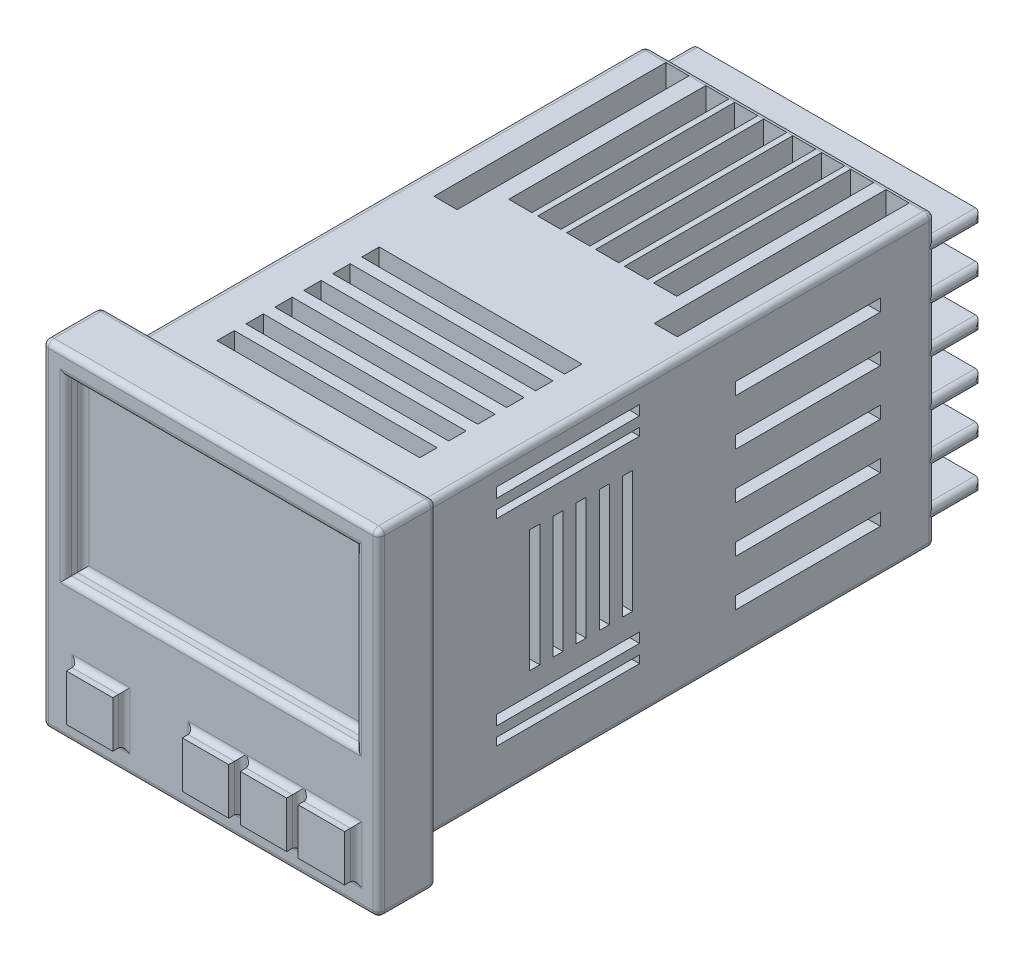
from build123d import *

# Parameters (mm, degrees)
ESBO_O1_W                = 50
ESBO_O1_H                = 50
RESSALTO_EXTRUS_O1_DEPTH = 100
ESBO_O2_W                = 58
ESBO_O2_H                = 58
ESBO_O2_W_2              = 50
ESBO_O2_H_2              = 50
RESSALTO_EXTRUS_O2_DEPTH = 10
ESBO_O3_W                = 50
ESBO_O3_H                = 30
CORTE_EXTRUS_O1_DEPTH    = 3
ESBO_O4_W                = 8
ESBO_O4_H                = 8
RESSALTO_EXTRUS_O3_DEPTH = 2
ESBO_O5_W                = 8
ESBO_O5_H                = 2
RESSALTO_EXTRUS_O4_DEPTH = 50
FILETE1_R                = 1
SKETCH1_W                = 25
SKETCH1_H                = 2.117547907
CUT_EXTRUDE1_DEPTH       = 10
LPATTERN1_COUNT          = 5
LPATTERN1_PITCH          = 8
SKETCH3_W                = 1.738778169
SKETCH3_H                = 21.0585356
CUT_EXTRUDE2_DEPTH       = 10
LPATTERN2_COUNT          = 5
LPATTERN2_PITCH          = 4
SKETCH5_W                = 24.653031409
SKETCH5_H                = 1.706748329
SKETCH5_H_2              = 1.327470922
CUT_EXTRUDE3_DEPTH       = 5
LPATTERN3_COUNT          = 2
LPATTERN3_PITCH          = 34
SKETCH7_W                = 4
SKETCH7_H                = 40
CUT_EXTRUDE4_DEPTH       = 5
SKETCH8_W                = 4
SKETCH8_H                = 34
CUT_EXTRUDE5_DEPTH       = 5
LPATTERN4_COUNT          = 6
LPATTERN4_PITCH          = 5
LPATTERN5_COUNT          = 2
LPATTERN5_PITCH          = 38
SKETCH10_W               = 35
SKETCH10_H               = 3
CUT_EXTRUDE6_DEPTH       = 5
LPATTERN6_COUNT          = 6
LPATTERN6_PITCH          = 5


with BuildPart() as part:
    # Esboço1 → Ressalto-extrusão1 (new body)
    with BuildSketch(Plane.XY):
        Rectangle(ESBO_O1_W, ESBO_O1_H)
    extrude(amount=RESSALTO_EXTRUS_O1_DEPTH)

    # Esboço2 → Ressalto-extrusão2 (add)
    with BuildSketch(Plane.XY.offset(100)):
        Rectangle(ESBO_O2_W, ESBO_O2_H)
        Rectangle(ESBO_O2_W_2, ESBO_O2_H_2, mode=Mode.SUBTRACT)
    extrude(amount=-RESSALTO_EXTRUS_O2_DEPTH)

    # Esboço3 → Corte-extrusão1 (cut)
    with BuildSketch(Plane.XY.offset(100)):
        with Locations((0, 10)):
            Rectangle(ESBO_O3_W, ESBO_O3_H)
    extrude(amount=-CORTE_EXTRUS_O1_DEPTH, mode=Mode.SUBTRACT)

    # Esboço4 → Ressalto-extrusão3 (add)
    with BuildSketch(Plane.XY.offset(100)):
        with Locations((-18.891491783, -20.652640119)):
            Rectangle(ESBO_O4_W, ESBO_O4_H)
        with Locations((1.108508217, -20.652640119)):
            Rectangle(ESBO_O4_W, ESBO_O4_H)
        with Locations((11.108508217, -20.652640119)):
            Rectangle(ESBO_O4_W, ESBO_O4_H)
        with Locations((21.108508217, -20.652640119)):
            Rectangle(ESBO_O4_W, ESBO_O4_H)
    extrude(amount=RESSALTO_EXTRUS_O3_DEPTH)

    # Esboço5 → Ressalto-extrusão4 (add)
    with BuildSketch(Plane(origin=(25, 0, 0), x_dir=(0, 0, -1), z_dir=(1, 0, 0))):
        with Locations((4, 20)):
            Rectangle(ESBO_O5_W, ESBO_O5_H)
        with Locations((4, 12)):
            Rectangle(ESBO_O5_W, ESBO_O5_H)
        with Locations((4, 4)):
            Rectangle(ESBO_O5_W, ESBO_O5_H)
        with Locations((4, -4)):
            Rectangle(ESBO_O5_W, ESBO_O5_H)
        with Locations((4, -12)):
            Rectangle(ESBO_O5_W, ESBO_O5_H)
        with Locations((4, -20)):
            Rectangle(ESBO_O5_W, ESBO_O5_H)
    extrude(amount=-RESSALTO_EXTRUS_O4_DEPTH)

    # Filete1
    filete1_edges = [part.edges().sort_by_distance(p)[0] for p in [
        (0, -25, 0),
        (-25, -25, 45),
        (0, -25, 90),
        (25, -25, 45),
        (25, -23, 0),
        (-25, -23, 0),
        (-25, 0, 90),
        (-25, 25, 45),
        (-25, 23, 0),
        (-25, 21, -4),
        (-25, 20, -8),
        (-25, 19, -4),
        (-25, 16, 0),
        (-25, 13, -4),
        (-25, 12, -8),
        (-25, 11, -4),
        (-25, 8, 0),
        (-25, 5, -4),
        (-25, 4, -8),
        (-25, 3, -4),
        (-25, 0, 0),
        (-25, -3, -4),
        (-25, -4, -8),
        (-25, -5, -4),
        (-25, -8, 0),
        (-25, -11, -4),
        (-25, -12, -8),
        (-25, -13, -4),
        (-25, -16, 0),
        (-25, -19, -4),
        (-25, -20, -8),
        (-25, -21, -4),
        (0, 29, 90),
        (-29, 0, 90),
        (0, -29, 90),
        (29, 0, 90),
        (0, 25, 90),
        (25, 0, 90),
        (25, 23, 0),
        (25, 25, 45),
        (25, -21, -4),
        (25, -20, -8),
        (25, -19, -4),
        (25, -16, 0),
        (25, -13, -4),
        (25, -12, -8),
        (25, -11, -4),
        (25, -8, 0),
        (25, -5, -4),
        (25, -4, -8),
        (25, -3, -4),
        (25, 0, 0),
        (25, 3, -4),
        (25, 4, -8),
        (25, 5, -4),
        (25, 8, 0),
        (25, 11, -4),
        (25, 12, -8),
        (25, 13, -4),
        (25, 16, 0),
        (25, 19, -4),
        (25, 20, -8),
        (25, 21, -4),
        (0, 25, 0),
        (29, 29, 95),
        (-29, 29, 95),
        (0, 29, 100),
        (-29, -29, 95),
        (-29, 0, 100),
        (29, -29, 95),
        (0, -29, 100),
        (29, 0, 100),
        (-22.891491783, -20.652640119, 100),
        (-18.891491783, -24.652640119, 100),
        (-14.891491783, -20.652640119, 100),
        (-18.891491783, -16.652640119, 100),
        (1.108508217, -24.652640119, 100),
        (5.108508217, -20.652640119, 100),
        (1.108508217, -16.652640119, 100),
        (-2.891491783, -20.652640119, 100),
        (11.108508217, -24.652640119, 100),
        (15.108508217, -20.652640119, 100),
        (11.108508217, -16.652640119, 100),
        (7.108508217, -20.652640119, 100),
        (21.108508217, -24.652640119, 100),
        (25.108508217, -20.652640119, 100),
        (21.108508217, -16.652640119, 100),
        (17.108508217, -20.652640119, 100),
        (25, 10, 100),
        (0, 25, 100),
        (0, -5, 100),
        (-25, 10, 100),
        (25, 10, 97),
        (0, 25, 97),
        (0, -5, 97),
        (-25, 10, 97),
    ]]
    fillet(filete1_edges, radius=FILETE1_R - 0.0001)  # a hair under: the kernel refuses the full size

    # Sketch1 → Cut-Extrude1 (cut)
    with BuildSketch(Plane(origin=(25, 0, 0), x_dir=(0, 0, -1), z_dir=(1, 0, 0))):
        with Locations((-21.939073973, 15.689104946)):
            Rectangle(SKETCH1_W, SKETCH1_H)
    cut_extrude1 = extrude(amount=-CUT_EXTRUDE1_DEPTH, mode=Mode.SUBTRACT)

    # LPattern1: Cut-Extrude1 ×5
    with Locations(*[(0, -i * LPATTERN1_PITCH, 0) for i in range(1, LPATTERN1_COUNT)]):
        add(cut_extrude1, mode=Mode.SUBTRACT)

    # Sketch3 → Cut-Extrude2 (cut)
    with BuildSketch(Plane(origin=(25, 0, 0), x_dir=(0, 0, -1), z_dir=(1, 0, 0))):
        with Locations((-69.067945394, 1.835376956)):
            Rectangle(SKETCH3_W, SKETCH3_H)
    cut_extrude2 = extrude(amount=-CUT_EXTRUDE2_DEPTH, mode=Mode.SUBTRACT)

    # LPattern2: Cut-Extrude2 ×5
    with Locations(*[(0, 0, -i * LPATTERN2_PITCH) for i in range(1, LPATTERN2_COUNT)]):
        add(cut_extrude2, mode=Mode.SUBTRACT)

    # Sketch5 → Cut-Extrude3 (cut)
    with BuildSketch(Plane(origin=(25, 0, 0), x_dir=(0, 0, -1), z_dir=(1, 0, 0))):
        with Locations((-63.321686576, 20.765437995)):
            Rectangle(SKETCH5_W, SKETCH5_H)
        with Locations((-63.321686576, 17.541580041)):
            Rectangle(SKETCH5_W, SKETCH5_H_2)
    cut_extrude3 = extrude(amount=-CUT_EXTRUDE3_DEPTH, mode=Mode.SUBTRACT)

    # LPattern3: Cut-Extrude3 ×2
    with Locations(*[(0, -i * LPATTERN3_PITCH, 0) for i in range(1, LPATTERN3_COUNT)]):
        add(cut_extrude3, mode=Mode.SUBTRACT)

    # Sketch7 → Cut-Extrude4 (cut)
    with BuildSketch(Plane(origin=(0, 25, 0), x_dir=(1, 0, 0), z_dir=(0, 1, 0))):
        with Locations((-18.458653289, -21)):
            Rectangle(SKETCH7_W, SKETCH7_H)
    cut_extrude4 = extrude(amount=-CUT_EXTRUDE4_DEPTH, mode=Mode.SUBTRACT)

    # Sketch8 → Cut-Extrude5 (cut)
    with BuildSketch(Plane(origin=(0, 25, 0), x_dir=(1, 0, 0), z_dir=(0, 1, 0))):
        with Locations((-11.563302007, -18)):
            Rectangle(SKETCH8_W, SKETCH8_H)
    cut_extrude5 = extrude(amount=-CUT_EXTRUDE5_DEPTH, mode=Mode.SUBTRACT)

    # LPattern4: Cut-Extrude5 ×6
    with Locations(*[(i * LPATTERN4_PITCH, 0, 0) for i in range(1, LPATTERN4_COUNT)]):
        add(cut_extrude5, mode=Mode.SUBTRACT)

    # LPattern5: Cut-Extrude4 ×2
    with Locations(*[(i * LPATTERN5_PITCH, 0, 0) for i in range(1, LPATTERN5_COUNT)]):
        add(cut_extrude4, mode=Mode.SUBTRACT)

    # Sketch10 → Cut-Extrude6 (cut)
    with BuildSketch(Plane(origin=(0, 25, 0), x_dir=(1, 0, 0), z_dir=(0, 1, 0))):
        with Locations((-0.116496261, -54.802539062)):
            Rectangle(SKETCH10_W, SKETCH10_H)
    cut_extrude6 = extrude(amount=-CUT_EXTRUDE6_DEPTH, mode=Mode.SUBTRACT)

    # LPattern6: Cut-Extrude6 ×6
    with Locations(*[(0, 0, i * LPATTERN6_PITCH) for i in range(1, LPATTERN6_COUNT)]):
        add(cut_extrude6, mode=Mode.SUBTRACT)


solid = part.part
